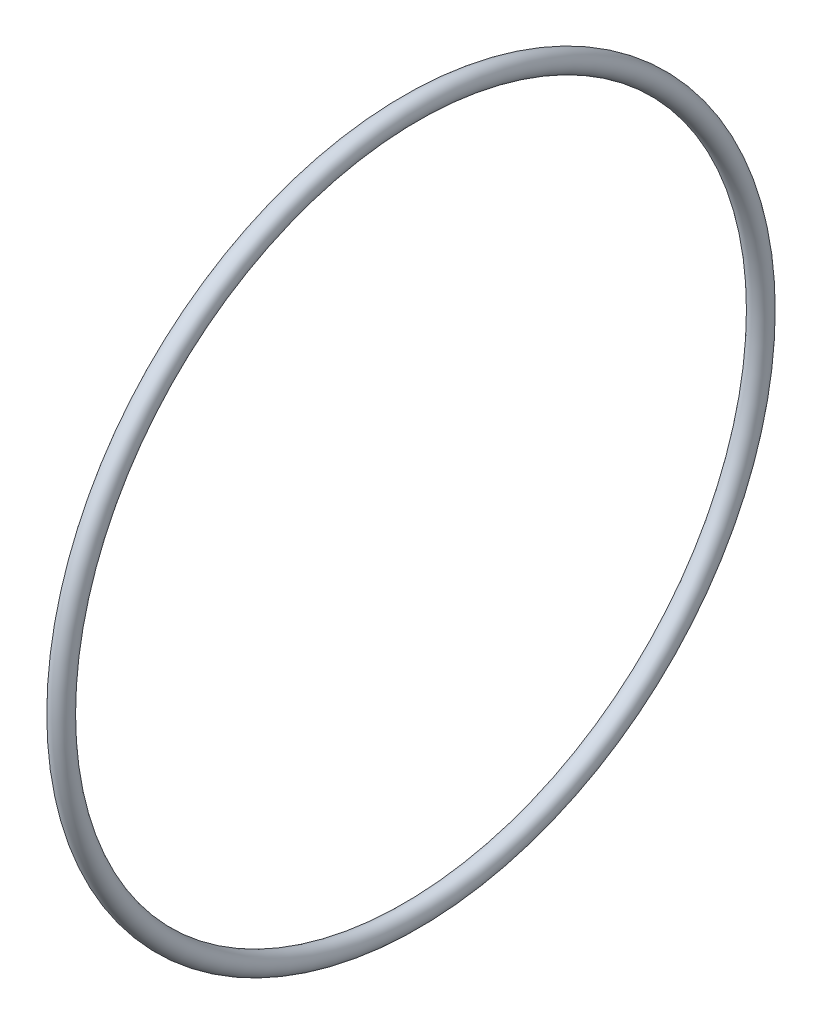
from build123d import *

# Parameters (mm, degrees)
SKETCH3_R = 0.899999978


with BuildPart() as part:
    # Sketch3 → Revolve1 (revolve)
    with BuildSketch(Plane.XY):
        with Locations((-0.900000232, 30.899999922)):
            Circle(SKETCH3_R)
    revolve(axis=Axis((0, 0, 0), (1, 0, 0)))


solid = part.part
